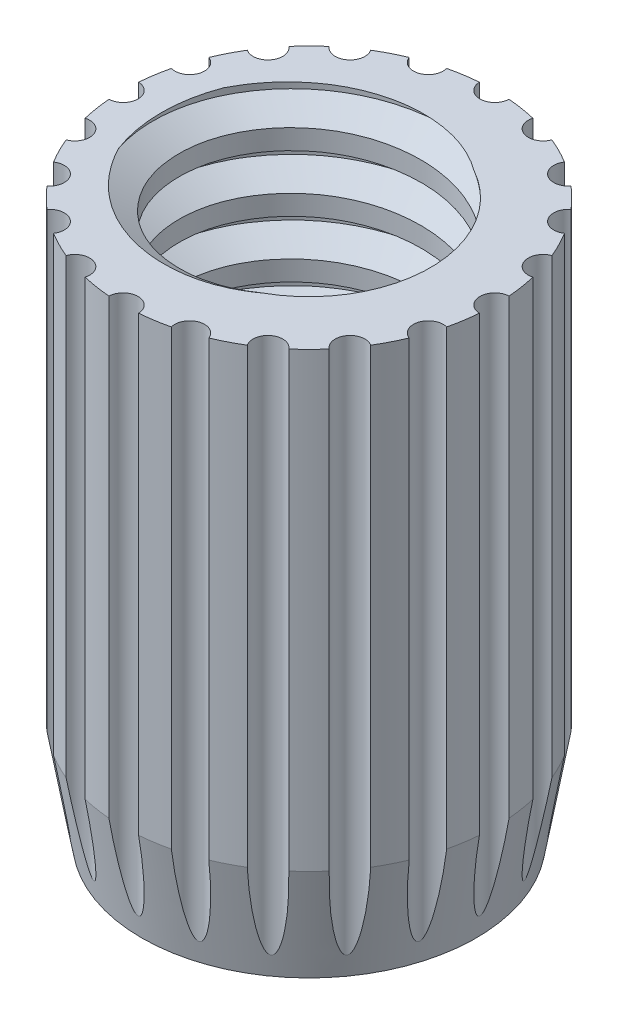
from build123d import *

# Parameters (mm, degrees)
SKETCH1_R                    = 5
BOSS_EXTRUDE1_DEPTH          = 15
F_5_16_18_TAPPED_HOLE1_D     = 6.5278
F_5_16_18_TAPPED_HOLE1_DEPTH = 10
F_5_16_18_TAPPED_HOLE1_TIP   = 1.961148974
CHAMFER1_SIZE                = 0.5
CHAMFER1_SIZE2               = 2.83564091
SKETCH5_R                    = 0.4
CUT_EXTRUDE2_DEPTH           = 17.583123952
CUT_SWEEP4_PITCH             = 1.53


with BuildPart() as part:
    # Sketch1 → Boss-Extrude1 (new body)
    with BuildSketch(Plane(origin=(0, 0, 0), x_dir=(1, 0, 0), z_dir=(0, 1, 0))):
        with Locations(Location((0, 0, 0), (0, 0, 270))):
            Circle(SKETCH1_R)
    extrude(amount=BOSS_EXTRUDE1_DEPTH)

    # 5/16-18 Tapped Hole1
    with Locations(Plane(origin=(0, 15, 0), x_dir=(1, 0, 0), z_dir=(0, 1, 0))):
        with Locations((0, 0)):
            Hole(F_5_16_18_TAPPED_HOLE1_D / 2, depth=F_5_16_18_TAPPED_HOLE1_DEPTH)
            with Locations((0, 0, -(F_5_16_18_TAPPED_HOLE1_DEPTH + F_5_16_18_TAPPED_HOLE1_TIP / 2))):  # 118° drill point
                Cone(0, F_5_16_18_TAPPED_HOLE1_D / 2, F_5_16_18_TAPPED_HOLE1_TIP, mode=Mode.SUBTRACT)

    # Cut-Loft1: read off the stored shape, not the designer's step
    # Cut-Loft1 outline → Cut-Loft1 (revolve, cut)
    with BuildSketch(Plane.XY):
        Polygon((2.5, 0), (3.2639, 5), (0, 3.038851026), (0, 0), align=None)
    revolve(axis=Axis((0, 0, 0), (0, 1, 0)), mode=Mode.SUBTRACT)

    # Chamfer1
    chamfer1_edges = [part.edges().sort_by_distance(p)[0] for p in [
        (0, 0, -5),
    ]]
    chamfer1_side = [part.faces().sort_by_distance(p)[0] for p in [
        (0, 0, -4.858578644),
    ]]
    chamfer(chamfer1_edges, length=CHAMFER1_SIZE, length2=CHAMFER1_SIZE2, reference=chamfer1_side[0])

    # Sketch5 → Cut-Extrude2 (cut, through all)
    with BuildSketch(Plane(origin=(0, 15, 0), x_dir=(1, 0, 0), z_dir=(0, 1, 0))):
        with Locations((0, 5)):
            Circle(SKETCH5_R)
        with Locations((1.545084972, 4.755282581)):
            Circle(SKETCH5_R)
        with Locations((2.938926261, 4.045084972)):
            Circle(SKETCH5_R)
        with Locations((4.045084972, 2.938926261)):
            Circle(SKETCH5_R)
        with Locations((4.755282581, 1.545084972)):
            Circle(SKETCH5_R)
        with Locations((5, 0)):
            Circle(SKETCH5_R)
        with Locations((4.755282581, -1.545084972)):
            Circle(SKETCH5_R)
        with Locations((4.045084972, -2.938926261)):
            Circle(SKETCH5_R)
        with Locations((2.938926261, -4.045084972)):
            Circle(SKETCH5_R)
        with Locations((1.545084972, -4.755282581)):
            Circle(SKETCH5_R)
        with Locations((0, -5)):
            Circle(SKETCH5_R)
        with Locations((-1.545084972, -4.755282581)):
            Circle(SKETCH5_R)
        with Locations((-2.938926261, -4.045084972)):
            Circle(SKETCH5_R)
        with Locations((-4.045084972, -2.938926261)):
            Circle(SKETCH5_R)
        with Locations((-4.755282581, -1.545084972)):
            Circle(SKETCH5_R)
        with Locations((-5, 0)):
            Circle(SKETCH5_R)
        with Locations((-4.755282581, 1.545084972)):
            Circle(SKETCH5_R)
        with Locations((-4.045084972, 2.938926261)):
            Circle(SKETCH5_R)
        with Locations((-2.938926261, 4.045084972)):
            Circle(SKETCH5_R)
        with Locations((-1.545084972, 4.755282581)):
            Circle(SKETCH5_R)
    extrude(amount=-CUT_EXTRUDE2_DEPTH, mode=Mode.SUBTRACT)

    # Cut-Sweep4: arcs per turn and ends read off the stored shape
    # Cut-Sweep4: the profile of Sketch6 screwed along a right-hand helix through 7 turns, 8 arcs to a turn; built about Z, then put on its axis
    cut_sweep4_z = Axis((0, 0, 0), (0, 0, 1))
    cut_sweep4_corners = [(3.115153208, 0, -2.279788384), (3.115153208, 0, -1.927010607), (3.981293208, 0, -1.426944444), (3.981293208, 0, -1.250555556), (3.115153208, 0, -0.750489393), (3.115153208, 0, -0.397711616), (0.012543208, 0, -0.397711616), (0.012543208, 0, -2.279788384)]
    with BuildLine(mode=Mode.PRIVATE) as cut_sweep4_profile:
        Line(cut_sweep4_corners[0], cut_sweep4_corners[1])
        Line(cut_sweep4_corners[1], cut_sweep4_corners[2])
        Line(cut_sweep4_corners[2], cut_sweep4_corners[3])
        Line(cut_sweep4_corners[3], cut_sweep4_corners[4])
        Line(cut_sweep4_corners[4], cut_sweep4_corners[5])
        Line(cut_sweep4_corners[5], cut_sweep4_corners[6])
        Line(cut_sweep4_corners[6], cut_sweep4_corners[7])
        Line(cut_sweep4_corners[7], cut_sweep4_corners[0])
    cut_sweep4_cap = Face(cut_sweep4_profile.wire())
    cut_sweep4_turn_angles = [0, 22.5, 45, 67.5, 90, 112.5, 135, 157.5, 180, 202.5, 225, 247.5, 270, 292.5, 315, 337.5, 360]
    cut_sweep4_turn_weights = [1, 0.9238795325112867, 1, 0.9238795325112867, 1, 0.9238795325112867, 1, 0.9238795325112867, 1, 0.9238795325112867, 1, 0.9238795325112867, 1, 0.9238795325112867, 1, 0.9238795325112867, 1]
    cut_sweep4_turn_rails = [Edge.make_bspline([Vector(p[0], p[1], 0).rotate(cut_sweep4_z, cut_sweep4_turn_angles[k]) / cut_sweep4_turn_weights[k] + Vector(0, 0, p[2] + CUT_SWEEP4_PITCH * cut_sweep4_turn_angles[k] / 360) for k in range(17)], [0, 0, 0, 1, 1, 2, 2, 3, 3, 4, 4, 5, 5, 6, 6, 7, 7, 8, 8, 8], 2, cut_sweep4_turn_weights) for p in cut_sweep4_corners]
    cut_sweep4_turn_sides = [Face.make_surface_from_curves(cut_sweep4_turn_rails[p[0]], cut_sweep4_turn_rails[p[1]]) for p in [(0, 1), (1, 2), (2, 3), (3, 4), (4, 5), (5, 6), (6, 7), (7, 0)]]
    cut_sweep4_turn = Solid(Shell([*cut_sweep4_turn_sides, cut_sweep4_cap, cut_sweep4_cap.rotate(cut_sweep4_z, 360).moved(Location((0, 0, CUT_SWEEP4_PITCH * 360 / 360)))]))
    cut_sweep4_each = [*[cut_sweep4_turn.moved(Location((0, 0, CUT_SWEEP4_PITCH * i))) for i in range(7)]]
    add(Plane(origin=(0.012543208, 15, 0), x_dir=(-0.7071067811865537, 0, -0.7071067811865415), z_dir=(0, -1, 0)) * Compound([cut_sweep4_each[i] for i in range(0, 7, 2)]), mode=Mode.SUBTRACT)
    add(Plane(origin=(0.012543208, 15, 0), x_dir=(-0.7071067811865537, 0, -0.7071067811865415), z_dir=(0, -1, 0)) * Compound([cut_sweep4_each[i] for i in range(1, 7, 2)]), mode=Mode.SUBTRACT)


solid = part.part
